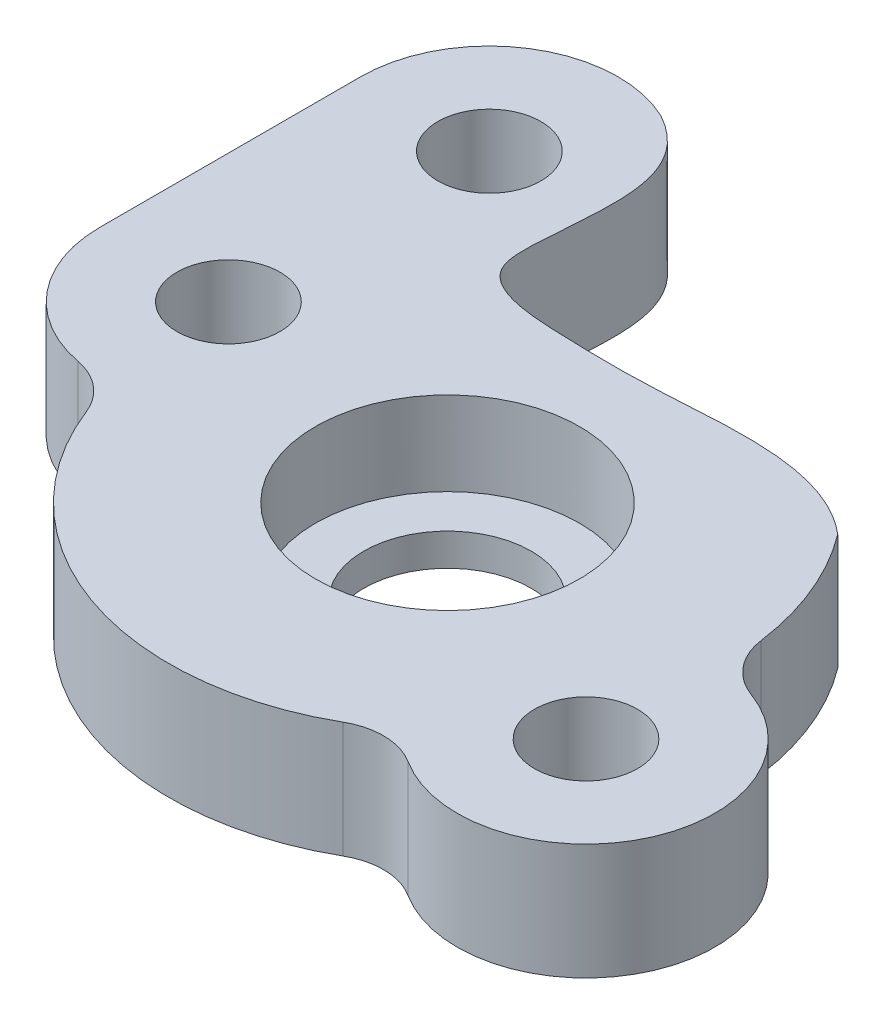
from build123d import *

# Parameters (mm, degrees)
SKETCH_1_W          = 30
SKETCH_1_H          = 30
EXTRUDE_1_DEPTH     = 3.6
SKETCH_2_R          = 1.6
SKETCH_2_R_2        = 4.1
CUT_EXTRUDE_1_DEPTH = 3.6
SKETCH_3_R          = 1.6
CUT_EXTRUDE_2_DEPTH = 3.6
EXTRUDE_START       = -1
SKETCH_4_R          = 4.1
SKETCH_4_R_2        = 2.6
EXTRUDE_2_DEPTH     = 1
SKETCH_5_OUTSIDE_W  = 40.516
SKETCH_5_OUTSIDE_H  = 40.516
CUT_EXTRUDE_3_DEPTH = 43.578867998
FILLET_1_R          = 2


with BuildPart() as part:
    # 草图1 → 凸台-拉伸1 (new body)
    with BuildSketch(Plane(origin=(0, 0, 0), x_dir=(1, 0, 0), z_dir=(0, 1, 0))):
        with Locations((15, 15)):
            Rectangle(SKETCH_1_W, SKETCH_1_H)
    extrude(amount=EXTRUDE_1_DEPTH)

    # 草图2 → 切除-拉伸1 (cut)
    with BuildSketch(Plane(origin=(0, 3.6, 0), x_dir=(1, 0, 0), z_dir=(0, 1, 0))):
        with Locations((21.35, 4.45)):
            Circle(SKETCH_2_R)
        with Locations((4.05, 10.65)):
            Circle(SKETCH_2_R)
        with Locations((12.85, 8.65)):
            Circle(SKETCH_2_R_2)
    extrude(amount=-CUT_EXTRUDE_1_DEPTH, mode=Mode.SUBTRACT)

    # 草图3 → 切除-拉伸2 (cut)
    with BuildSketch(Plane(origin=(0, 3.6, 0), x_dir=(1, 0, 0), z_dir=(0, 1, 0))):
        with Locations((4.05, 18.75)):
            Circle(SKETCH_3_R)
    extrude(amount=-CUT_EXTRUDE_2_DEPTH, mode=Mode.SUBTRACT)

    # 草图4 → 凸台-拉伸2 (add)
    with BuildSketch(Plane(origin=(0, 0, 0), x_dir=(-1, 0, 0), z_dir=(0, -1, 0)).offset(EXTRUDE_START)):
        with Locations((-12.85, 8.65)):
            Circle(SKETCH_4_R)
        with Locations((-12.85, 8.65)):
            Circle(SKETCH_4_R_2, mode=Mode.SUBTRACT)
    extrude(amount=EXTRUDE_2_DEPTH)

    # 草图5 outside → 切除-拉伸3 (cut, through all)
    with BuildSketch(Plane.XZ):
        with Locations((15, -15)):
            Rectangle(SKETCH_5_OUTSIDE_W, SKETCH_5_OUTSIDE_H)
        with BuildLine():
            Line((0.05, -10.65), (0.05, -18.75))
            ThreePointArc((0.05, -18.75), (1.906724352, -22.127331713), (5.753184749, -22.369276407))
            add(Edge.make_bspline(
                [(5.753184749, -22.369276407), (7.856031174, -21.224967164), (7.262348844, -18.732422861), (7.214645145, -15.042618263), (10.325081743, -14.911894874), (14.194025599, -14.869290972), (17.851959703, -15.47124448), (19.755845457, -13.858819302)],
                knots=[0, 0, 0, 0, 0.297903311, 0.356444213, 0.512120996, 0.640128316, 1, 1, 1, 1], degree=3))
            ThreePointArc((19.755845457, -13.858819302), (21.084003087, -11.300225114), (21.497624099, -8.447274962))
            ThreePointArc((21.497624099, -8.447274962), (24.936106861, -2.678041316), (18.264632548, -1.904315871))
            ThreePointArc((18.264632548, -1.904315871), (10.03374211, -0.471296466), (4.430108237, -6.668101241))
            ThreePointArc((4.430108237, -6.668101241), (1.359315417, -7.690233713), (0.05, -10.65))
        make_face(mode=Mode.SUBTRACT)
    extrude(amount=-CUT_EXTRUDE_3_DEPTH, mode=Mode.SUBTRACT)

    # 圆角1
    fillet_1_edges = [part.edges().sort_by_distance(p)[0] for p in [
        (21.497624099, 1.8, -8.447274962),
        (4.430108237, 1.8, -6.668101241),
        (18.264632548, 1.8, -1.904315871),
    ]]
    fillet(fillet_1_edges, radius=FILLET_1_R)


solid = part.part
